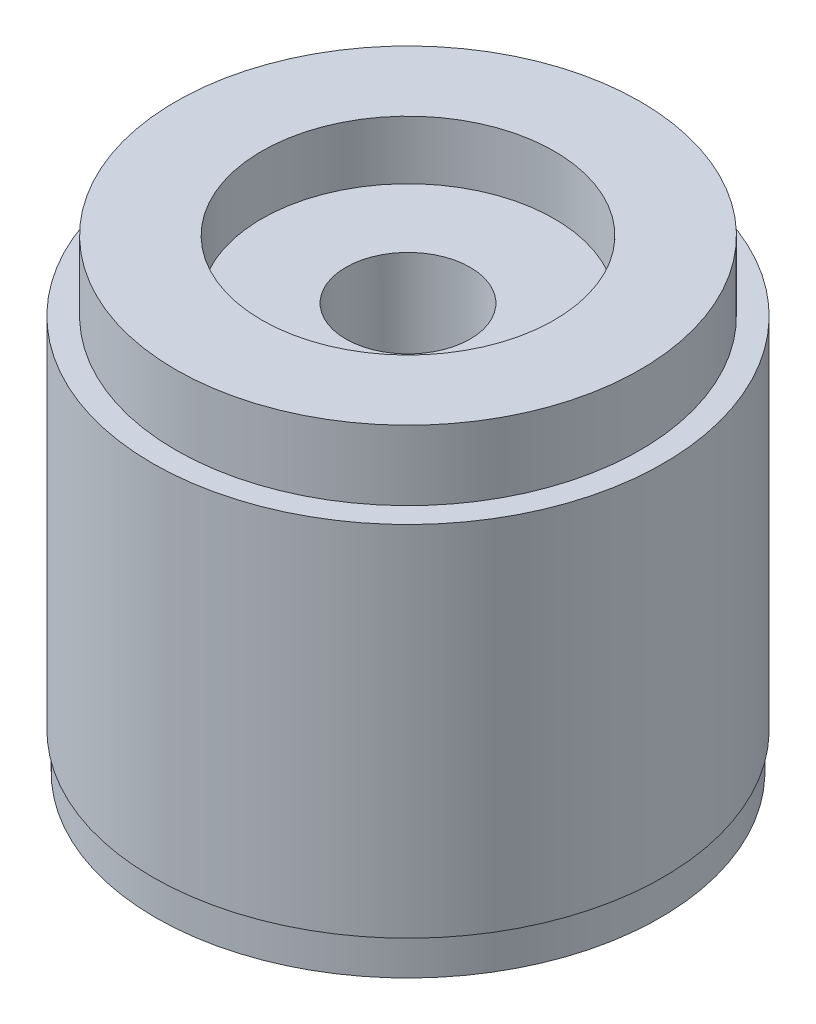
from build123d import *

# Parameters (mm, degrees)
SKETCH1_R           = 34.91
BOSS_EXTRUDE1_DEPTH = 63.5
SKETCH2_OUTSIDE_W   = 95.3
SKETCH2_OUTSIDE_H   = 95.3
SKETCH2_OUTSIDE_R   = 34.5
CUT_EXTRUDE1_DEPTH  = 5
SKETCH3_OUTSIDE_W   = 95.3
SKETCH3_OUTSIDE_H   = 95.3
SKETCH3_OUTSIDE_R   = 31.75
CUT_EXTRUDE2_DEPTH  = 9.52
SKETCH4_R           = 20
CUT_EXTRUDE3_DEPTH  = 8
SKETCH5_R           = 8.5
CUT_EXTRUDE4_DEPTH  = 81.434235248
SKETCH6_R           = 14.5
CUT_EXTRUDE5_DEPTH  = 5


with BuildPart() as part:
    # Sketch1 → Boss-Extrude1 (new body)
    with BuildSketch(Plane(origin=(0, 0, 0), x_dir=(1, 0, 0), z_dir=(0, 1, 0))):
        Circle(SKETCH1_R)
    extrude(amount=BOSS_EXTRUDE1_DEPTH)

    # Sketch2 outside → Cut-Extrude1 (cut)
    with BuildSketch(Plane.XZ):
        Rectangle(SKETCH2_OUTSIDE_W, SKETCH2_OUTSIDE_H)
        Circle(SKETCH2_OUTSIDE_R, mode=Mode.SUBTRACT)
    extrude(amount=-CUT_EXTRUDE1_DEPTH, mode=Mode.SUBTRACT)

    # Sketch3 outside → Cut-Extrude2 (cut)
    with BuildSketch(Plane(origin=(0, 63.5, 0), x_dir=(1, 0, 0), z_dir=(0, 1, 0))):
        Rectangle(SKETCH3_OUTSIDE_W, SKETCH3_OUTSIDE_H)
        Circle(SKETCH3_OUTSIDE_R, mode=Mode.SUBTRACT)
    extrude(amount=-CUT_EXTRUDE2_DEPTH, mode=Mode.SUBTRACT)

    # Sketch4 → Cut-Extrude3 (cut)
    with BuildSketch(Plane(origin=(0, 63.5, 0), x_dir=(1, 0, 0), z_dir=(0, 1, 0))):
        Circle(SKETCH4_R)
    extrude(amount=-CUT_EXTRUDE3_DEPTH, mode=Mode.SUBTRACT)

    # Sketch5 → Cut-Extrude4 (cut, through all)
    with BuildSketch(Plane.XZ):
        Circle(SKETCH5_R)
    extrude(amount=-CUT_EXTRUDE4_DEPTH, mode=Mode.SUBTRACT)

    # Sketch6 → Cut-Extrude5 (cut)
    with BuildSketch(Plane.XZ):
        Circle(SKETCH6_R)
    extrude(amount=-CUT_EXTRUDE5_DEPTH, mode=Mode.SUBTRACT)


solid = part.part
